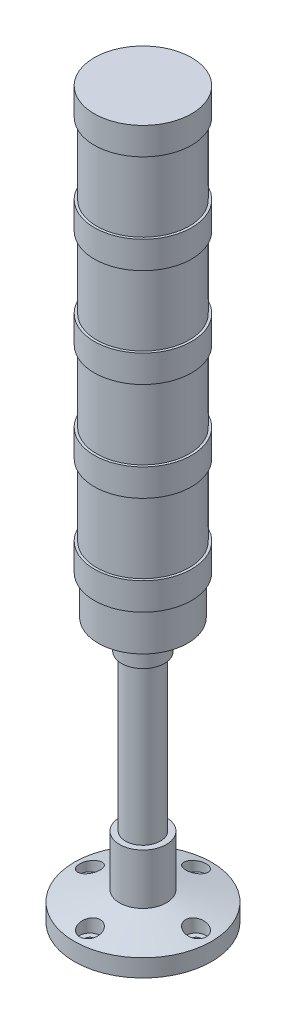
from build123d import *

# Parameters (mm, degrees)
SKETCH1_R           = 35.25
BOSS_EXTRUDE1_DEPTH = 9
SKETCH3_R           = 12
BOSS_EXTRUDE2_DEPTH = 26
SKETCH4_R           = 9
BOSS_EXTRUDE3_DEPTH = 80
SKETCH5_R           = 11
BOSS_EXTRUDE4_DEPTH = 10
SKETCH7_R           = 23
BOSS_EXTRUDE5_DEPTH = 20
SKETCH9_R           = 2.65
CUT_EXTRUDE1_DEPTH  = 20
CUT_EXTRUDE2_START  = 45
SKETCH11_R          = 5.25
CUT_EXTRUDE2_DEPTH  = 40


with BuildPart() as part:
    # Sketch1 → Boss-Extrude1 (new body)
    with BuildSketch(Plane(origin=(0, 0, 0), x_dir=(1, 0, 0), z_dir=(0, 1, 0))):
        Circle(SKETCH1_R)
    extrude(amount=BOSS_EXTRUDE1_DEPTH)

    # Sketch2 → Revolve1 (revolve)
    with BuildSketch(Plane.XY):
        Polygon((0, 9), (0, 14.5), (12, 14.5), (35.25, 9), align=None)
    revolve(axis=Axis((0, 9, 0), (0, 1, 0)))

    # Sketch3 → Boss-Extrude2 (add)
    with BuildSketch(Plane(origin=(0, 14.5, 0), x_dir=(1, 0, 0), z_dir=(0, 1, 0))):
        Circle(SKETCH3_R)
    extrude(amount=BOSS_EXTRUDE2_DEPTH)

    # Sketch4 → Boss-Extrude3 (add)
    with BuildSketch(Plane(origin=(0, 40.5, 0), x_dir=(1, 0, 0), z_dir=(0, 1, 0))):
        Circle(SKETCH4_R)
    extrude(amount=BOSS_EXTRUDE3_DEPTH)

    # Sketch5 → Boss-Extrude4 (add)
    with BuildSketch(Plane(origin=(0, 120.5, 0), x_dir=(1, 0, 0), z_dir=(0, 1, 0))):
        Circle(SKETCH5_R)
    extrude(amount=BOSS_EXTRUDE4_DEPTH)

    # Sketch6 → Revolve2 (revolve)
    with BuildSketch(Plane.XY):
        Polygon((0, 130.5), (0, 135.5), (23, 135.5), (11, 130.5), align=None)
    revolve(axis=Axis((0, 130.5, 0), (0, 1, 0)))

    # Sketch7 → Boss-Extrude5 (add)
    with BuildSketch(Plane(origin=(0, 135.5, 0), x_dir=(1, 0, 0), z_dir=(0, 1, 0))):
        Circle(SKETCH7_R)
    extrude(amount=BOSS_EXTRUDE5_DEPTH)

    # Sketch8 → Revolve6 (revolve)
    with BuildSketch(Plane.XY):
        Polygon((-25, 155.5), (0, 155.5), (0, 372.060698134), (-25, 372.060698134), (-25, 358.060698134), (-23.75, 358.060698134), (-23.75, 321.420523601), (-25, 321.420523601), (-25, 307.420523601), (-23.75, 307.420523601), (-23.75, 270.780349067), (-25, 270.780349067), (-25, 256.780349067), (-23.75, 256.780349067), (-23.75, 220.140174534), (-25, 220.140174534), (-25, 206.140174534), (-23.75, 206.140174534), (-23.75, 169.5), (-25, 169.5), align=None)
    revolve(axis=Axis((0, 155.5, 0), (0, 1, 0)))

    # Sketch9 → Cut-Extrude1 (cut)
    with BuildSketch(Plane.XZ):
        with Locations((0, 27.25)):
            Circle(SKETCH9_R)
        with Locations((27.25, 0)):
            Circle(SKETCH9_R)
        with Locations((0, -27.25)):
            Circle(SKETCH9_R)
        with Locations((-27.25, 0)):
            Circle(SKETCH9_R)
    extrude(amount=-CUT_EXTRUDE1_DEPTH, mode=Mode.SUBTRACT)

    # Sketch11 → Cut-Extrude2 (cut)
    with BuildSketch(Plane(origin=(0, 0, 0), x_dir=(1, 0, 0), z_dir=(0, 1, 0)).offset(CUT_EXTRUDE2_START)):
        with Locations((0, 27.25)):
            Circle(SKETCH11_R)
        with Locations((27.25, 0)):
            Circle(SKETCH11_R)
        with Locations((0, -27.25)):
            Circle(SKETCH11_R)
        with Locations((-27.25, 0)):
            Circle(SKETCH11_R)
    extrude(amount=-CUT_EXTRUDE2_DEPTH, mode=Mode.SUBTRACT)


solid = part.part
